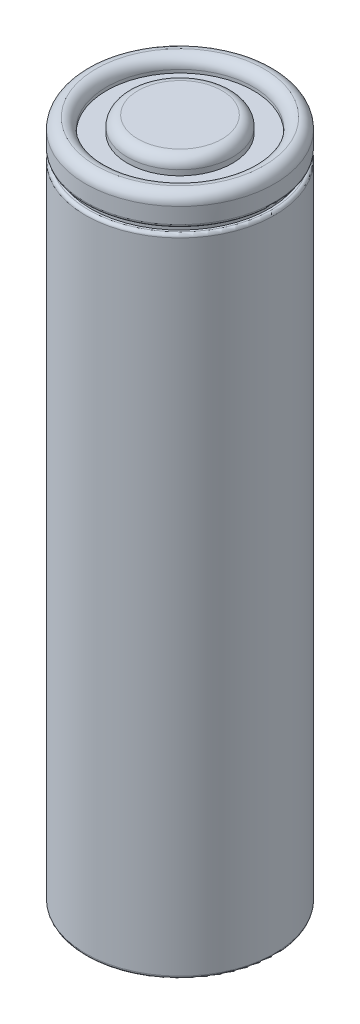
from build123d import *

# Parameters (mm, degrees)
SKETCH1_R           = 9
BOSS_EXTRUDE1_DEPTH = 65
SKETCH2_W           = 0.5
SKETCH2_H           = 0.5
FILLET1_R           = 1
FILLET2_R           = 0.3


with BuildPart() as part:
    # Sketch1 → Boss-Extrude1 (new body)
    with BuildSketch(Plane(origin=(0, 0, 0), x_dir=(1, 0, 0), z_dir=(0, 1, 0))):
        with Locations(Location((0, 0, 0), (0, 0, 270))):
            Circle(SKETCH1_R)
    extrude(amount=BOSS_EXTRUDE1_DEPTH)

    # Sketch2 → Cut-Revolve1 (revolve, cut)
    with BuildSketch(Plane.XY, mode=Mode.PRIVATE) as cut_revolve1_sk:
        Polygon((5, 65), (5, 63.5), (7, 63.5), (7, 64.8), (9, 64.8), (9, 65), align=None)
        with Locations((8.75, 61.75)):
            Rectangle(SKETCH2_W, SKETCH2_H)
    revolve(cut_revolve1_sk.sketch.rotate(Axis((0, 65, 0), (0, -1, 0)), 90), axis=Axis((0, 65, 0), (0, -1, 0)), mode=Mode.SUBTRACT)

    # Fillet1
    fillet1_edges = [part.edges().sort_by_distance(p)[0] for p in [
        (0, 65, -5),
        (0, 64.8, -7),
        (0, 64.8, -9),
    ]]
    fillet(fillet1_edges, radius=FILLET1_R - 0.0001)  # a hair under: the kernel refuses the full size

    # Fillet2
    fillet2_edges = [part.edges().sort_by_distance(p)[0] for p in [
        (0, 61.5, -9),
        (0, 62, -9),
        (0, 0, -9),
    ]]
    fillet(fillet2_edges, radius=FILLET2_R)


solid = part.part
